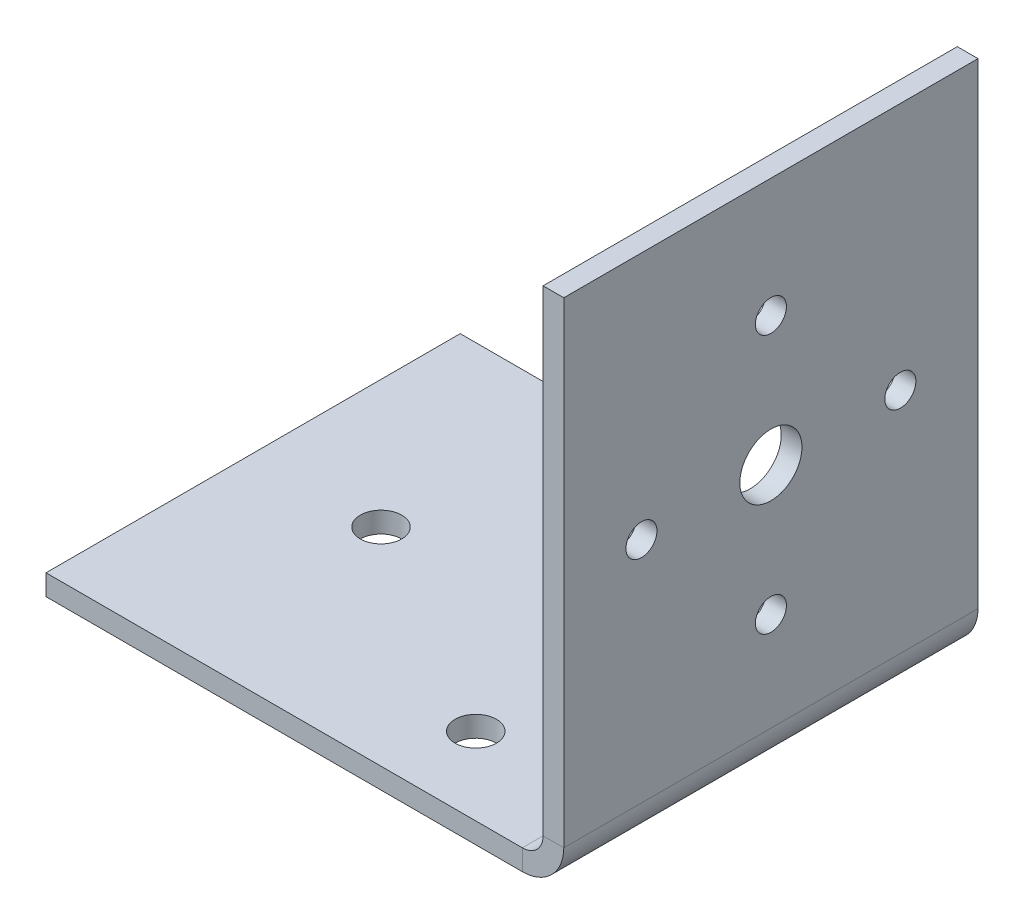
from build123d import *

# Parameters (mm, degrees)
RESSALTO_EXTRUS_O1_DEPTH  = 20
ESBO_O2_R                 = 3
CORTE_EXTRUS_O1_DEPTH     = 50
CONVERTER_S_LIDO1_START   = -21
CONVERTER_S_LIDO1_DEPTH   = 41
CONVERTER_S_LIDO1_START_2 = -20
CONVERTER_S_LIDO1_2_DEPTH = 40
ESBO_O3_R                 = 2
CORTE_EXTRUS_O2_DEPTH     = 10
ESBO_O4_R                 = 1.5
CORTE_EXTRUS_O3_DEPTH     = 8


with BuildPart() as part:
    # Esboço1 → Ressalto-extrusão1 (new, symmetric)
    with BuildSketch(Plane.XY):
        Polygon((23, 49), (23, 1), (-25, 1), (-25, -1), (23, -1), (25, -1), (25, 1), (25, 49), align=None)
    extrude(amount=RESSALTO_EXTRUS_O1_DEPTH, both=True)

    # Esboço2 → Corte-extrusão1 (cut)
    with BuildSketch(Plane(origin=(25, 0, 0), x_dir=(0, 0, -1), z_dir=(1, 0, 0))):
        with Locations((0, 25.02)):
            Circle(ESBO_O2_R)
    extrude(amount=-CORTE_EXTRUS_O1_DEPTH, mode=Mode.SUBTRACT)

    # Converter-Sólido1: read off the stored shape, not the designer's step
    # Converter-Sólido1 outline → Converter-Sólido1 (cut)
    with BuildSketch(Plane.XY.offset(CONVERTER_S_LIDO1_START)):
        with BuildLine():
            Line((25, -1), (25, 3))
            ThreePointArc((25, 3), (23.828427125, 0.171572875), (21, -1))
            Line((21, -1), (25, -1))
        make_face()
    extrude(amount=CONVERTER_S_LIDO1_DEPTH, mode=Mode.SUBTRACT)

    # Converter-S_lido1 2 outline → Converter-S_lido1 2 (add)
    with BuildSketch(Plane.XY.offset(CONVERTER_S_LIDO1_START_2)):
        with BuildLine():
            Line((23, 1), (23, 3))
            ThreePointArc((23, 3), (22.414213562, 1.585786438), (21, 1))
            Line((21, 1), (23, 1))
        make_face()
    extrude(amount=CONVERTER_S_LIDO1_2_DEPTH)

    # Esboço3 → Corte-extrusão2 (cut)
    with BuildSketch(Plane.XZ.offset(1)):
        with Locations(Location((9, 12.5, 0), (0, 0, 270))):
            Circle(ESBO_O3_R)
        with Locations(Location((9, -12.5, 0), (0, 0, 270))):
            Circle(ESBO_O3_R)
        with Locations(Location((-12.650635095, 0, 0), (0, 0, 270))):
            Circle(ESBO_O3_R)
    extrude(amount=-CORTE_EXTRUS_O2_DEPTH, mode=Mode.SUBTRACT)

    # Esboço4 → Corte-extrusão3 (cut)
    with BuildSketch(Plane(origin=(25, 0, 0), x_dir=(0, 0, -1), z_dir=(1, 0, 0))):
        with Locations((0, 37.52)):
            Circle(ESBO_O4_R)
        with Locations((12.5, 25.02)):
            Circle(ESBO_O4_R)
        with Locations((0, 12.52)):
            Circle(ESBO_O4_R)
        with Locations((-12.5, 25.02)):
            Circle(ESBO_O4_R)
    extrude(amount=-CORTE_EXTRUS_O3_DEPTH, mode=Mode.SUBTRACT)


solid = part.part
